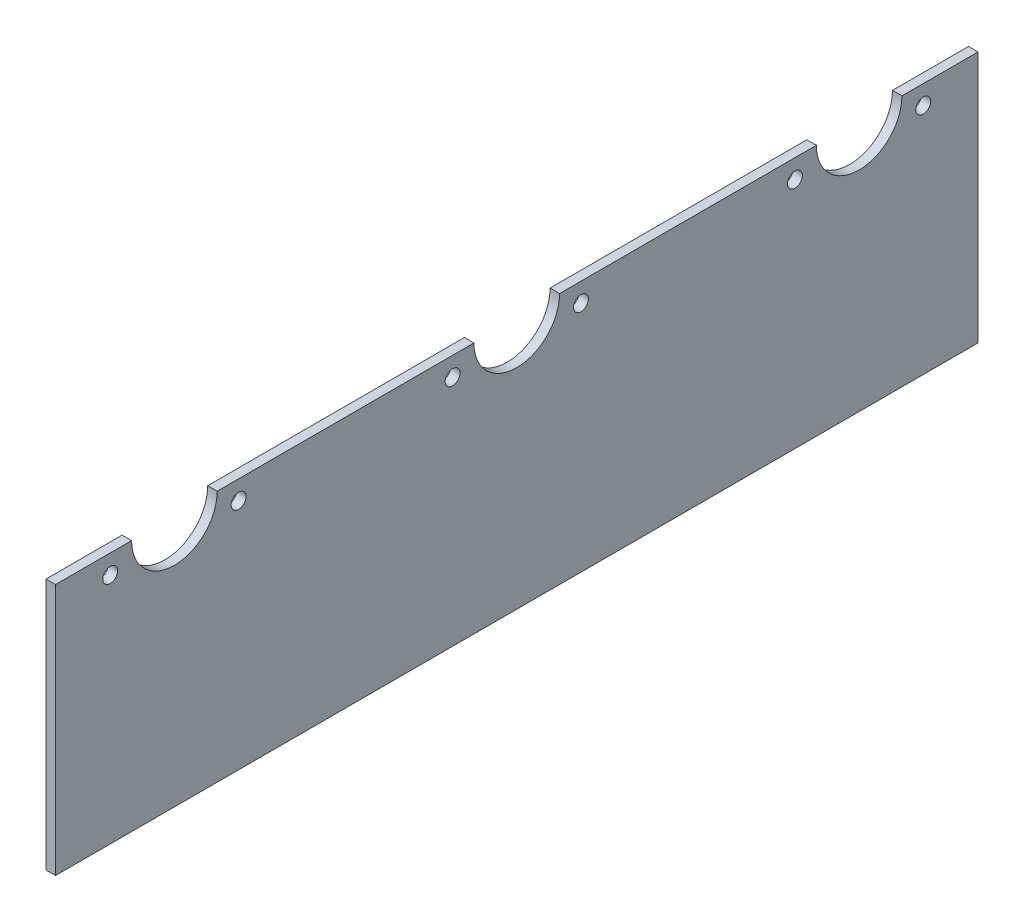
from build123d import *

# Parameters (mm, degrees)
BOSS_EXTRUDE1_DEPTH    = 3.175
F_10_CLEARANCE_HOLE1_D = 4.9784


with BuildPart() as part:
    # Sketch1 → Boss-Extrude1 (new body)
    with BuildSketch(Plane(origin=(0, 0, 0), x_dir=(0, 0, -1), z_dir=(1, 0, 0))):
        with BuildLine():
            Line((153.9875, 0), (-153.9875, 0))
            Line((-153.9875, 0), (-153.9875, 84.1375))
            Line((-153.9875, 84.1375), (-128.5875, 84.1375))
            ThreePointArc((-128.5875, 84.1375), (-114.3, 69.85), (-100.0125, 84.1375))
            Line((-100.0125, 84.1375), (-14.2875, 84.1375))
            ThreePointArc((-14.2875, 84.1375), (0, 69.85), (14.2875, 84.1375))
            Line((14.2875, 84.1375), (100.0125, 84.1375))
            ThreePointArc((100.0125, 84.1375), (114.3, 69.85), (128.5875, 84.1375))
            Line((128.5875, 84.1375), (153.9875, 84.1375))
            Line((153.9875, 84.1375), (153.9875, 0))
        make_face()
    extrude(amount=BOSS_EXTRUDE1_DEPTH)

    # #10 Clearance Hole1 (through all)
    with Locations(Plane(origin=(3.175, 0, 0), x_dir=(0, 0, -1), z_dir=(1, 0, 0))):
        with Locations((-135.73125, 77.7875), (-92.86875, 77.7875), (-21.43125, 77.7875), (21.43125, 77.7875), (92.86875, 77.7875), (135.73125, 77.7875)):
            Hole(F_10_CLEARANCE_HOLE1_D / 2)


solid = part.part
